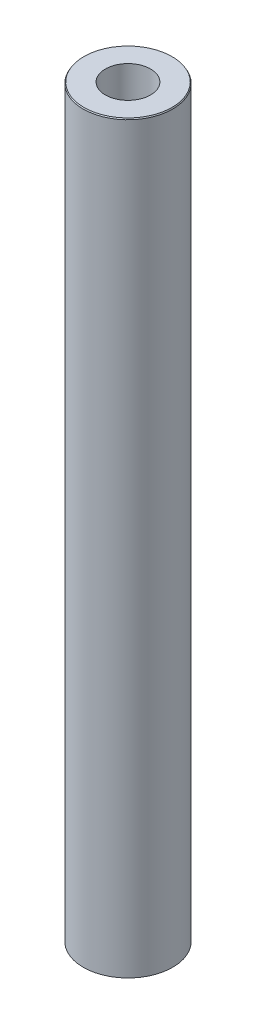
from build123d import *
from OCP.BRepFilletAPI import BRepFilletAPI_MakeChamfer

# Parameters (mm, degrees)
SKETCH1_R           = 12.5
BOSS_EXTRUDE1_DEPTH = 208.268692322
SKETCH2_R           = 6.309445719
CUT_EXTRUDE1_DEPTH  = 210.01757869
CHAMFER1_SIZE       = 0.31839847
CHAMFER1_SIZE2      = 0.183827442


with BuildPart() as part:
    # Sketch1 → Boss-Extrude1 (new body)
    with BuildSketch(Plane(origin=(0, 0, 0), x_dir=(1, 0, 0), z_dir=(0, 1, 0))):
        Circle(SKETCH1_R)
    extrude(amount=BOSS_EXTRUDE1_DEPTH)

    # Sketch2 → Cut-Extrude1 (cut, through all)
    with BuildSketch(Plane(origin=(0, 0, 0), x_dir=(1, 0, 0), z_dir=(0, 1, 0))):
        Circle(SKETCH2_R)
    extrude(amount=CUT_EXTRUDE1_DEPTH, mode=Mode.SUBTRACT)

    # Chamfer1: one chamfer whose edges measure the first distance from different faces: ONE call of the kernel's chamfer builder (chamfer() names one face for all edges)
    chamfer1_edges_1 = [part.edges().sort_by_distance(p)[0] for p in [
        (-12.5, 208.268692322, 0),
    ]]
    chamfer1_side_1 = [part.faces().sort_by_distance(p)[0] for p in [
        (-12.5, 104.134346161, 0),
    ]]
    chamfer1_edges_2 = [part.edges().sort_by_distance(p)[0] for p in [
        (-12.5, 0, 0),
    ]]
    chamfer1_side_2 = [part.faces().sort_by_distance(p)[0] for p in [
        (-12.146446609, 0, 0),
    ]]
    chamfer1 = BRepFilletAPI_MakeChamfer(part.part.solid().wrapped)
    for e in chamfer1_edges_1:
        chamfer1.Add(CHAMFER1_SIZE, CHAMFER1_SIZE2, e.wrapped, chamfer1_side_1[0].wrapped)  # the first distance lies on this face
    for e in chamfer1_edges_2:
        chamfer1.Add(CHAMFER1_SIZE, CHAMFER1_SIZE2, e.wrapped, chamfer1_side_2[0].wrapped)  # the first distance lies on this face
    add(Compound.cast(chamfer1.Shape()), mode=Mode.REPLACE)


solid = part.part
